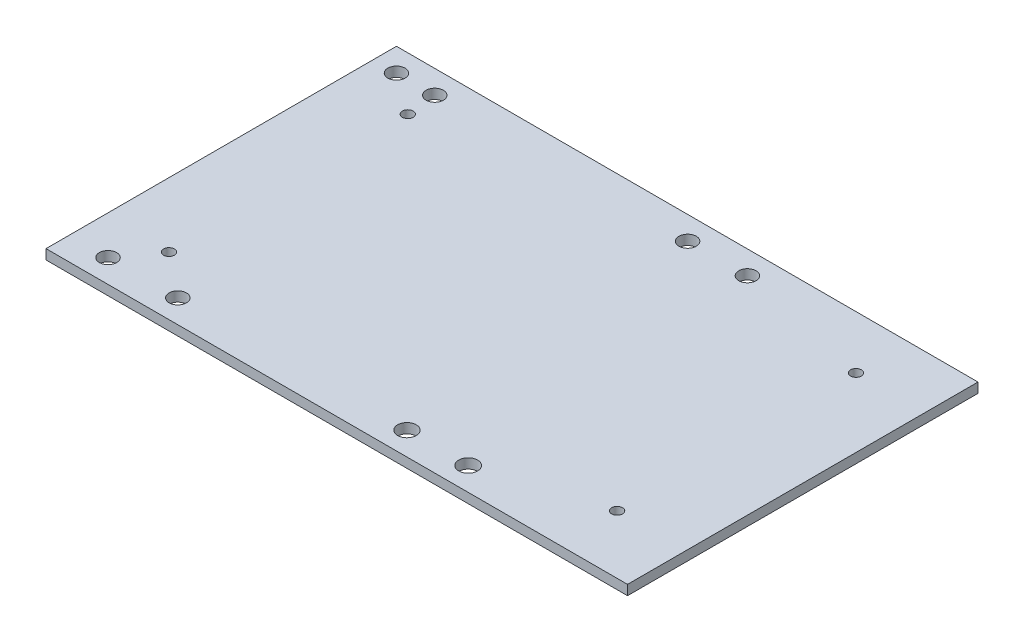
from build123d import *

# Parameters (mm, degrees)
SKETCH1_W           = 375
SKETCH1_H           = 226
SKETCH1_R           = 5.581785531
SKETCH1_R_2         = 6.018247546
SKETCH1_R_3         = 6.106953205
SKETCH1_R_4         = 3.5
BOSS_EXTRUDE1_DEPTH = 6.35


with BuildPart() as part:
    # Sketch1 → Boss-Extrude1 (new body)
    with BuildSketch(Plane(origin=(0, 0, 0), x_dir=(1, 0, 0), z_dir=(0, 1, 0))):
        with Locations((187.5, -113)):
            Rectangle(SKETCH1_W, SKETCH1_H)
        with Locations((15, -15)):
            Circle(SKETCH1_R, mode=Mode.SUBTRACT)
        with Locations((39.680379951, -15)):
            Circle(SKETCH1_R, mode=Mode.SUBTRACT)
        with Locations((25, -211)):
            Circle(SKETCH1_R, mode=Mode.SUBTRACT)
        with Locations((70, -211)):
            Circle(SKETCH1_R, mode=Mode.SUBTRACT)
        with Locations((241.3, -15)):
            Circle(SKETCH1_R, mode=Mode.SUBTRACT)
        with Locations((202.757534631, -15)):
            Circle(SKETCH1_R, mode=Mode.SUBTRACT)
        with Locations((217.757534631, -211)):
            Circle(SKETCH1_R_2, mode=Mode.SUBTRACT)
        with Locations((257.244291662, -211)):
            Circle(SKETCH1_R_3, mode=Mode.SUBTRACT)
        with Locations((41.566569972, -34.281355599)):
            Circle(SKETCH1_R_4, mode=Mode.SUBTRACT)
        with Locations((41.566569972, -188.281355599)):
            Circle(SKETCH1_R_4, mode=Mode.SUBTRACT)
        with Locations((330.566569972, -188.281355599)):
            Circle(SKETCH1_R_4, mode=Mode.SUBTRACT)
        with Locations((330.566569972, -34.281355599)):
            Circle(SKETCH1_R_4, mode=Mode.SUBTRACT)
    extrude(amount=-BOSS_EXTRUDE1_DEPTH)


solid = part.part
